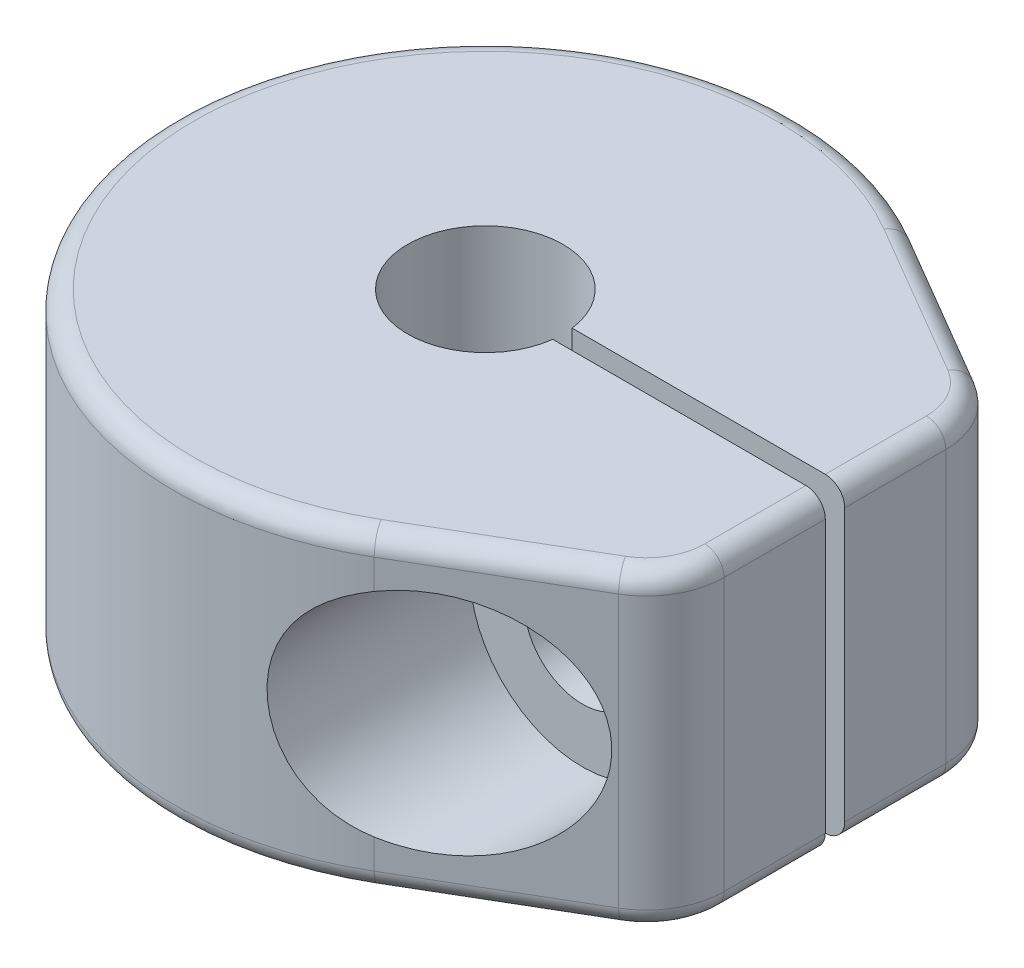
from build123d import *

# Parameters (mm, degrees)
BOSS_EXTRU_1_DEPTH           = 4
ENL_V_MAT_EXTRU_1_DEPTH      = 13.68857754
ENL_V_MAT_EXTRU_1_DEPTH_BACK = 13.68857754
ESQUISSE2_R                  = 1.5
ENL_V_START                  = -2.5
ENL_V_MAT_EXTRU_2_DEPTH      = 11.188577635
ENL_V_START_2                = 2.5
ESQUISSE4_R                  = 2.9
ENL_V_MAT_EXTRU_3_DEPTH      = 8
CONG_1_R                     = 2
CONG_2_R                     = 0.5


with BuildPart() as part:
    # Esquisse1 → Boss.-Extru.1 (new, symmetric)
    with BuildSketch(Plane(origin=(0, 0, 0), x_dir=(1, 0, 0), z_dir=(0, 1, 0))):
        with BuildLine():
            Line((4.043030879, 6.903180521), (9, 4))
            Line((9, 4), (9, 0.25))
            Line((9, 0.25), (1.984313483, 0.25))
            ThreePointArc((1.984313483, 0.25), (-2, 0), (1.984313483, -0.25))
            Line((1.984313483, -0.25), (9, -0.25))
            Line((9, -0.25), (9, -4))
            Line((9, -4), (4.043030879, -6.903180521))
            ThreePointArc((4.043030879, -6.903180521), (-8, 0), (4.043030879, 6.903180521))
        make_face()
    extrude(amount=BOSS_EXTRU_1_DEPTH, both=True)

    # Esquisse2 → Enlèv. mat.-Extru.1 (cut, two sides: drawn at the far end of the back side and taken through both)
    with BuildSketch(Plane.XY.offset(-ENL_V_MAT_EXTRU_1_DEPTH_BACK)):
        with Locations((5, 0)):
            Circle(ESQUISSE2_R)
    extrude(amount=ENL_V_MAT_EXTRU_1_DEPTH + ENL_V_MAT_EXTRU_1_DEPTH_BACK, mode=Mode.SUBTRACT)

    # Esquisse3 → Enlèv. mat.-Extru.2 (cut, through all)
    with BuildSketch(Plane.XY.offset(ENL_V_START)):
        Polygon((2.25, 1.58771324), (2.25, -1.58771324), (5, -3.175426481), (7.75, -1.58771324), (7.75, 1.58771324), (5, 3.175426481), align=None)
    extrude(amount=-ENL_V_MAT_EXTRU_2_DEPTH, mode=Mode.SUBTRACT)

    # Esquisse4 → Enlèv. mat.-Extru.3 (cut)
    with BuildSketch(Plane.XY.offset(ENL_V_START_2)):
        with Locations((5, 0)):
            Circle(ESQUISSE4_R)
    extrude(amount=ENL_V_MAT_EXTRU_3_DEPTH, mode=Mode.SUBTRACT)

    # Congé1
    cong_1_edges = [part.edges().sort_by_distance(p)[0] for p in [
        (9, 0, -4),
        (9, 0, 4),
    ]]
    fillet(cong_1_edges, radius=CONG_1_R)

    # Congé2
    cong_2_edges = [part.edges().sort_by_distance(p)[0] for p in [
        (9, -4, -1.551790433),
        (8.735153515, -4, -3.848187461),
        (6.0268943, -4, -5.741278258),
        (-8, -4, 0),
        (6.0268943, -4, 5.741278258),
        (8.735153515, -4, 3.848187461),
        (9, 4, -1.551790433),
        (8.735153515, 4, -3.848187461),
        (6.0268943, 4, -5.741278258),
        (-8, 4, 0),
        (6.0268943, 4, 5.741278258),
        (8.735153515, 4, 3.848187461),
        (9, -4, 1.551790433),
        (9, 4, 1.551790433),
    ]]
    fillet(cong_2_edges, radius=CONG_2_R)


solid = part.part
